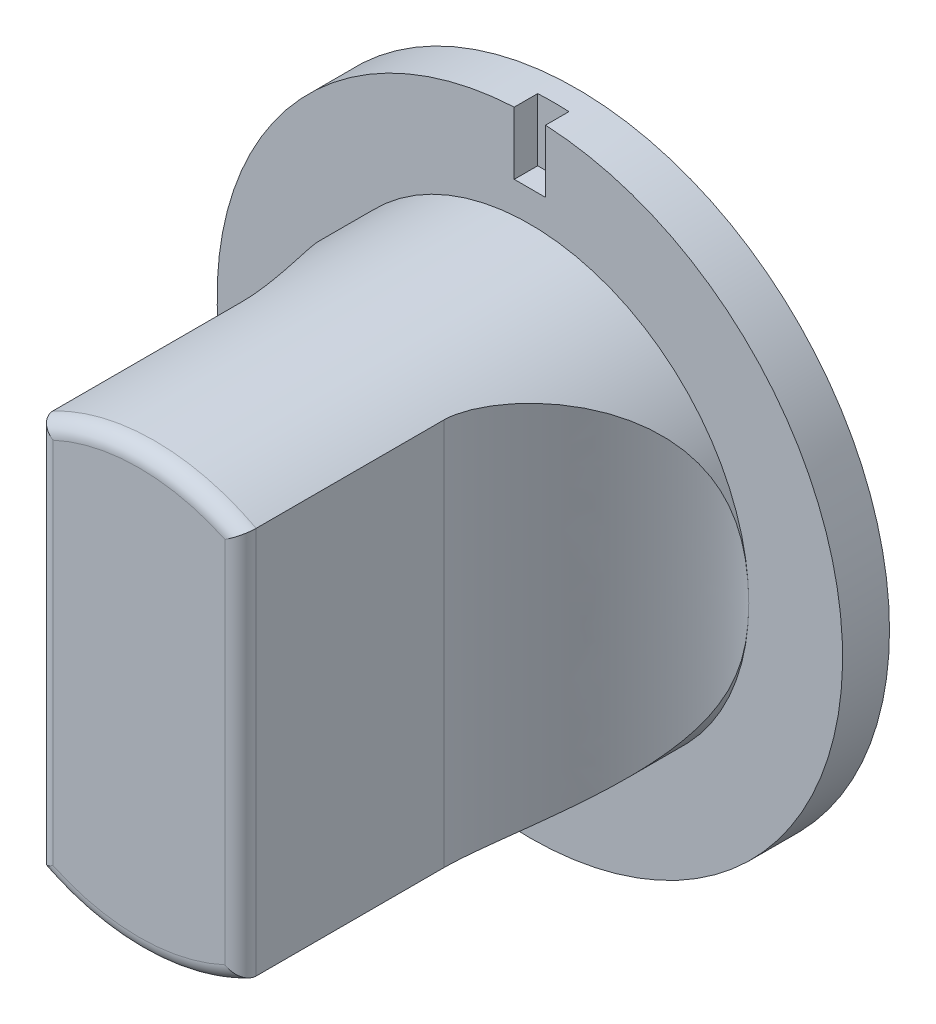
from build123d import *

# Parameters (mm, degrees)
SKETCH1_R           = 10
BOSS_EXTRUDE1_DEPTH = 1.5
BOSS_EXTRUDE2_DEPTH = 12.5
CUT_EXTRUDE2_START  = -0.75
CUT_EXTRUDE2_DEPTH  = 0.75
SKETCH5_R           = 3.1
CUT_EXTRUDE3_DEPTH  = 7
FILLET5_SIZE        = 3.75
FILLET5_SIZE_2      = 6
FILLET6_R           = 0.5


with BuildPart() as part:
    # Sketch1 → Boss-Extrude1 (new body)
    with BuildSketch(Plane.XY):
        Circle(SKETCH1_R)
    extrude(amount=BOSS_EXTRUDE1_DEPTH)

    # Sketch2 → Boss-Extrude2 (add)
    with BuildSketch(Plane.XY.offset(1.5)):
        with BuildLine():
            Line((-3.25, 6.199798384), (-3.25, -6.199798384))
            ThreePointArc((-3.25, -6.199798384), (0, -7), (3.25, -6.199798384))
            Line((3.25, -6.199798384), (3.25, 6.199798384))
            ThreePointArc((3.25, 6.199798384), (0, 7), (-3.25, 6.199798384))
        make_face()
    extrude(amount=BOSS_EXTRUDE2_DEPTH)

    # Sketch4 → Cut-Extrude2 (cut)
    with BuildSketch(Plane.XY.offset(1.5).offset(CUT_EXTRUDE2_START)):
        with BuildLine():
            Line((-0.5, 9.987492178), (-0.5, 7.987492178))
            Line((-0.5, 7.987492178), (0.5, 7.987492178))
            Line((0.5, 7.987492178), (0.5, 9.987492178))
            ThreePointArc((0.5, 9.987492178), (0, 10), (-0.5, 9.987492178))
        make_face()
    extrude(amount=CUT_EXTRUDE2_DEPTH, mode=Mode.SUBTRACT)

    # Sketch5 → Cut-Extrude3 (cut)
    with BuildSketch(Plane(origin=(0, 0, 0), x_dir=(-1, 0, 0), z_dir=(0, 0, -1))):
        Circle(SKETCH5_R)
    extrude(amount=-CUT_EXTRUDE3_DEPTH, mode=Mode.SUBTRACT)

    # Fillet5
    # a fillet whose section is not a circle: 6, 3.75 mm, written as the material it adds along each edge
    with BuildSketch(Plane(origin=(-3.25, 21.199798384, 1.5), x_dir=(-1, 0, 0), z_dir=(0, -1, 0))) as fillet5_piece_1_section:
        with BuildLine():
            Bezier((FILLET5_SIZE, 0), (0, 0), (0, -FILLET5_SIZE_2), weights=[1, 0.333333333, 1])
            Line((0, -FILLET5_SIZE_2), (0, 0))
            Line((0, 0), (FILLET5_SIZE, 0))
        make_face()
    fillet5_piece_1 = extrude(amount=42.399596768, mode=Mode.PRIVATE)
    fillet5_piece_1 = fillet5_piece_1 & Plane(origin=(0, 0, 1.5), x_dir=(0.4642857142857146, 0.8856854834026602, 0), z_dir=(0, 0, -1)) * Cylinder(7, 109, mode=Mode.PRIVATE)
    add(fillet5_piece_1)
    with BuildSketch(Plane(origin=(3.25, -21.199798384, 1.5), x_dir=(1, 0, 0), z_dir=(0, 1, 0))) as fillet5_piece_2_section:
        with BuildLine():
            Bezier((FILLET5_SIZE, 0), (0, 0), (0, -FILLET5_SIZE_2), weights=[1, 0.333333333, 1])
            Line((0, -FILLET5_SIZE_2), (0, 0))
            Line((0, 0), (FILLET5_SIZE, 0))
        make_face()
    fillet5_piece_2 = extrude(amount=42.399596768, mode=Mode.PRIVATE)
    fillet5_piece_2 = fillet5_piece_2 & Plane(origin=(0, 0, 1.5), x_dir=(0.4642857142857146, 0.8856854834026602, 0), z_dir=(0, 0, -1)) * Cylinder(7, 109, mode=Mode.PRIVATE)
    add(fillet5_piece_2)

    # Fillet6
    fillet6_edges = [part.edges().sort_by_distance(p)[0] for p in [
        (3.25, 0, 14),
        (0, -7, 14),
        (-3.25, 0, 14),
        (0, 7, 14),
    ]]
    fillet(fillet6_edges, radius=FILLET6_R)


solid = part.part
